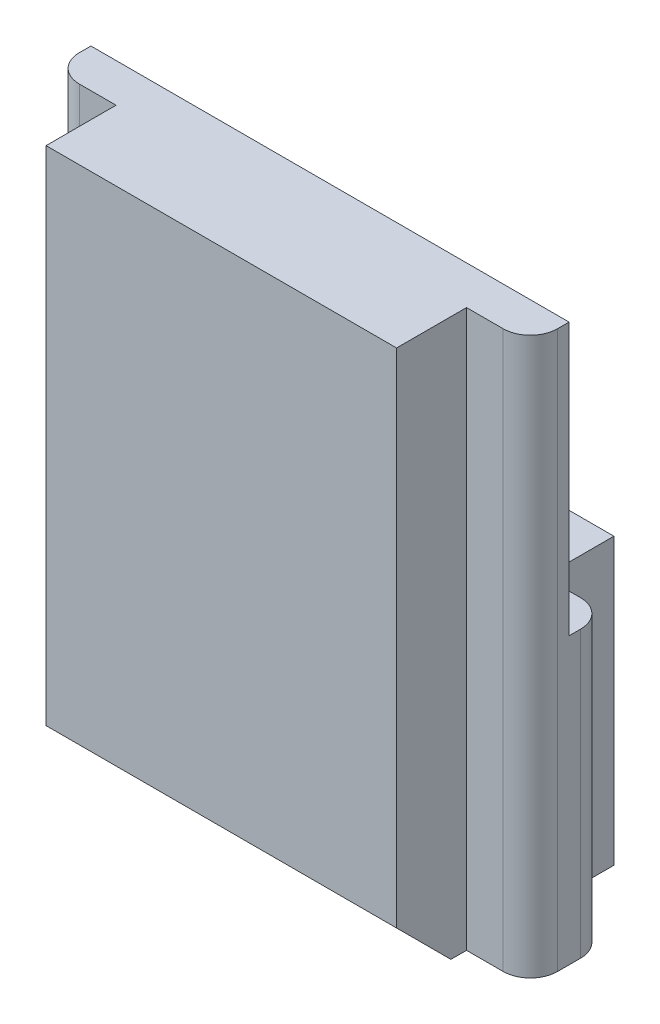
from build123d import *

# Parameters (mm, degrees)
ESQUISSE1_W             = 12.9
ESQUISSE1_H             = 8
ESQUISSE1_W_2           = 2.35
ESQUISSE1_H_2           = 2.85
BOSS_EXTRU_1_DEPTH      = 20.49
CHANFREIN1_SIZE         = 2
ESQUISSE2_W             = 17.6
ESQUISSE2_H             = 4
ENL_V_MAT_EXTRU_1_DEPTH = 10
CONG_1_R                = 1


with BuildPart() as part:
    # Esquisse1 → Boss.-Extru.1 (new body)
    with BuildSketch(Plane(origin=(0, 0, 0), x_dir=(1, 0, 0), z_dir=(0, 1, 0))):
        with Locations((6.45, 4)):
            Rectangle(ESQUISSE1_W, ESQUISSE1_H)
        with Locations((-1.175, 4)):
            Rectangle(ESQUISSE1_W_2, ESQUISSE1_H_2)
        with Locations((14.075, 4)):
            Rectangle(ESQUISSE1_W_2, ESQUISSE1_H_2)
    extrude(amount=BOSS_EXTRU_1_DEPTH)

    # Chanfrein1
    chanfrein1_edges = [part.edges().sort_by_distance(p)[0] for p in [
        (6.45, 0, 0),
    ]]
    chamfer(chanfrein1_edges, length=CHANFREIN1_SIZE)

    # Esquisse2 → Enlèv. mat.-Extru.1 (cut)
    with BuildSketch(Plane(origin=(0, 20.49, 0), x_dir=(1, 0, 0), z_dir=(0, 1, 0))):
        with Locations((6.45, 6)):
            Rectangle(ESQUISSE2_W, ESQUISSE2_H)
    extrude(amount=-ENL_V_MAT_EXTRU_1_DEPTH, mode=Mode.SUBTRACT)

    # Congé1
    cong_1_edges = [part.edges().sort_by_distance(p)[0] for p in [
        (15.25, 5.245, -5.425),
        (-2.35, 5.245, -5.425),
        (-2.35, 10.245, -2.575),
        (15.25, 10.245, -2.575),
    ]]
    fillet(cong_1_edges, radius=CONG_1_R)


solid = part.part
